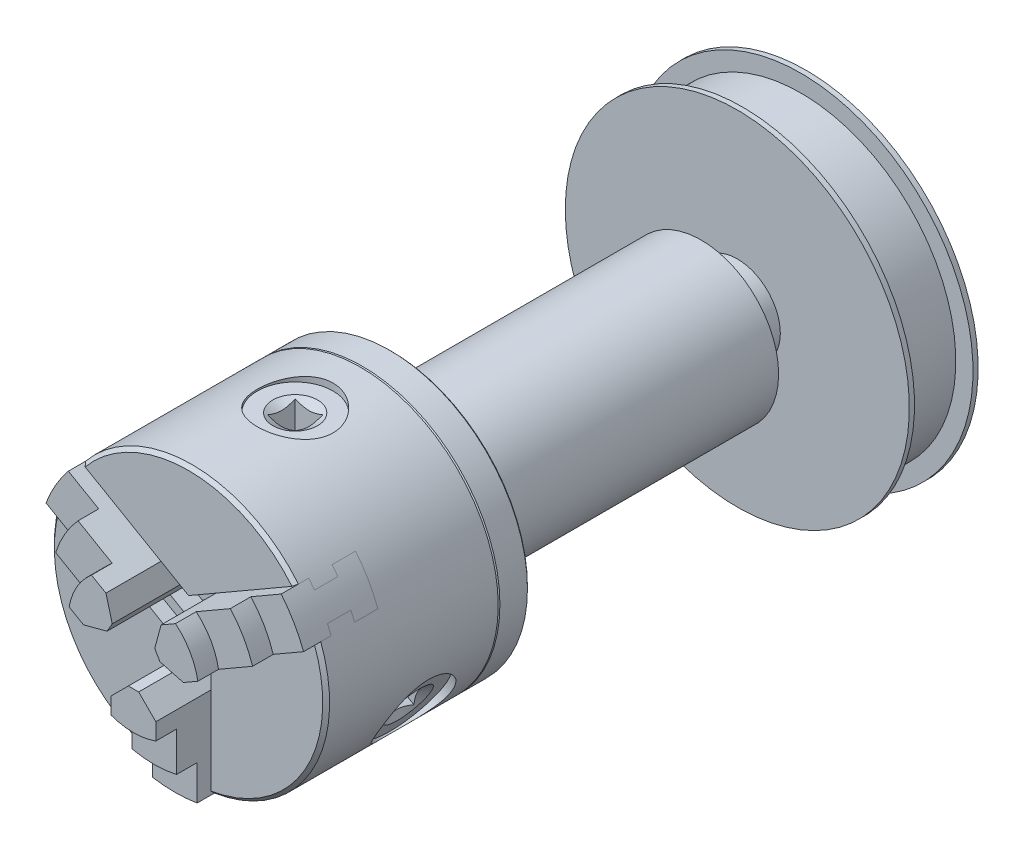
from build123d import *

# Parameters (mm, degrees)
SKETCH1_R            = 22.5
BOSS_EXTRUDE1_DEPTH  = 80
SKETCH2_R            = 12.5
BOSS_EXTRUDE2_DEPTH  = 10.5
SKETCH3_R            = 50
BOSS_EXTRUDE3_DEPTH  = 1.5
SKETCH4_R            = 45
BOSS_EXTRUDE4_DEPTH  = 17
SKETCH5_R            = 50
BOSS_EXTRUDE5_DEPTH  = 1.5
SKETCH6_R            = 12.5
BOSS_EXTRUDE6_DEPTH  = 1.5
SKETCH7_R            = 6
BOSS_EXTRUDE7_DEPTH  = 8
BOSS_EXTRUDE8_START  = 2
SKETCH8_R            = 12.5
BOSS_EXTRUDE8_DEPTH  = 2
SKETCH9_R            = 22.5
BOSS_EXTRUDE9_DEPTH  = 8
SKETCH10_R           = 40
BOSS_EXTRUDE10_DEPTH = 9
CHAMFER1_SIZE        = 0.5
SKETCH11_R           = 40
BOSS_EXTRUDE11_DEPTH = 50
CHAMFER2_SIZE        = 1
CUT_EXTRUDE1_START   = 38
SKETCH12_R           = 11
CUT_EXTRUDE1_DEPTH   = 127.927256692
SKETCH13_W           = 8
SKETCH13_H           = 8
CUT_EXTRUDE2_DEPTH   = 13
CIRPATTERN1_COUNT    = 3
CUT_EXTRUDE4_DEPTH   = 165.927256692
CIRPATTERN2_COUNT    = 3
BOSS_EXTRUDE12_START = -8
BOSS_EXTRUDE12_DEPTH = 32
CHAMFER3_SIZE        = 5
CIRPATTERN6_COUNT    = 3
SKETCH18_R           = 56.962173473
SKETCH18_R_2         = 19
CUT_EXTRUDE5_DEPTH   = 6
SKETCH20_R           = 66.142717287
SKETCH20_R_2         = 30
CUT_EXTRUDE6_DEPTH   = 6
CUT_EXTRUDE7_START   = -25
SKETCH21_R           = 72.147326136
SKETCH21_R_2         = 40
CUT_EXTRUDE7_DEPTH   = 25


with BuildPart() as part:
    # Sketch1 → Boss-Extrude1 (new body)
    with BuildSketch(Plane.XY):
        Circle(SKETCH1_R)
    extrude(amount=BOSS_EXTRUDE1_DEPTH)

    # Sketch2 → Boss-Extrude2 (add)
    with BuildSketch(Plane(origin=(0, 0, 0), x_dir=(-1, 0, 0), z_dir=(0, 0, -1))):
        Circle(SKETCH2_R)
    extrude(amount=BOSS_EXTRUDE2_DEPTH)

    # Sketch3 → Boss-Extrude3 (add)
    with BuildSketch(Plane(origin=(0, 0, -10.5), x_dir=(-1, 0, 0), z_dir=(0, 0, -1))):
        Circle(SKETCH3_R)
    extrude(amount=BOSS_EXTRUDE3_DEPTH)

    # Sketch4 → Boss-Extrude4 (add)
    with BuildSketch(Plane(origin=(0, 0, -12), x_dir=(-1, 0, 0), z_dir=(0, 0, -1))):
        Circle(SKETCH4_R)
    extrude(amount=BOSS_EXTRUDE4_DEPTH)

    # Sketch5 → Boss-Extrude5 (add)
    with BuildSketch(Plane(origin=(0, 0, -29), x_dir=(-1, 0, 0), z_dir=(0, 0, -1))):
        Circle(SKETCH5_R)
    extrude(amount=BOSS_EXTRUDE5_DEPTH)

    # Sketch8 → Boss-Extrude8 (add)
    with BuildSketch(Plane.XY.offset(80).offset(BOSS_EXTRUDE8_START)):
        Circle(SKETCH8_R)
    extrude(amount=-BOSS_EXTRUDE8_DEPTH)

    # Sketch9 → Boss-Extrude9 (add)
    with BuildSketch(Plane.XY.offset(82)):
        Circle(SKETCH9_R)
    extrude(amount=BOSS_EXTRUDE9_DEPTH)

    # Sketch10 → Boss-Extrude10 (add)
    with BuildSketch(Plane.XY.offset(90)):
        Circle(SKETCH10_R)
    extrude(amount=BOSS_EXTRUDE10_DEPTH)

    # Chamfer1
    chamfer1_edges = [part.edges().sort_by_distance(p)[0] for p in [
        (-40, 0, 99),
        (-40, 0, 90),
    ]]
    chamfer(chamfer1_edges, length=CHAMFER1_SIZE)

    # Sketch11 → Boss-Extrude11 (add)
    with BuildSketch(Plane.XY.offset(99)):
        Circle(SKETCH11_R)
    extrude(amount=BOSS_EXTRUDE11_DEPTH)

    # Chamfer2
    chamfer2_edges = [part.edges().sort_by_distance(p)[0] for p in [
        (-40, 0, 149),
    ]]
    chamfer(chamfer2_edges, length=CHAMFER2_SIZE)

    # Sketch12 → Cut-Extrude1 (cut, through all)
    with BuildSketch(Plane(origin=(0, 0, 0), x_dir=(1, 0, 0), z_dir=(0, 1, 0)).offset(CUT_EXTRUDE1_START)):
        with Locations((0, -118)):
            Circle(SKETCH12_R)
    cut_extrude1 = extrude(amount=CUT_EXTRUDE1_DEPTH, mode=Mode.SUBTRACT)

    # Sketch13 → Cut-Extrude2 (cut)
    with BuildSketch(Plane(origin=(0, 38, 0), x_dir=(1, 0, 0), z_dir=(0, 1, 0))):
        with Locations((0, -118)):
            Rectangle(SKETCH13_W, SKETCH13_H)
    cut_extrude2 = extrude(amount=-CUT_EXTRUDE2_DEPTH, mode=Mode.SUBTRACT)

    # Cut-Extrude3 cone 1 section (through the dimple's axis) → Cut-Extrude3 (revolve, cut)
    with BuildSketch(Plane(origin=(0, 38, 118), x_dir=(0, 0, 1), z_dir=(1, 0, 0))):
        Polygon((0, 0), (6.5, 0), (0, 3.75277675), align=None)
    cut_extrude3 = revolve(axis=Axis((0, 38, 118), (0, -1, 0)), mode=Mode.SUBTRACT)

    # CirPattern1: Cut-Extrude1, Cut-Extrude2, Cut-Extrude3 ×3 about axis
    cirpattern1_axis = Axis((0, 0, 149), (0, 0, 1))
    add([cut_extrude1.rotate(cirpattern1_axis, i * 360 / CIRPATTERN1_COUNT) for i in range(1, CIRPATTERN1_COUNT)], mode=Mode.SUBTRACT)
    add([cut_extrude2.rotate(cirpattern1_axis, i * 360 / CIRPATTERN1_COUNT) for i in range(1, CIRPATTERN1_COUNT)], mode=Mode.SUBTRACT)
    add([cut_extrude3.rotate(cirpattern1_axis, i * 360 / CIRPATTERN1_COUNT) for i in range(1, CIRPATTERN1_COUNT)], mode=Mode.SUBTRACT)

    # Sketch16 → Cut-Extrude4 (cut, through all)
    with BuildSketch(Plane(origin=(0, 0, 0), x_dir=(1, 0, 0), z_dir=(0, 1, 0))):
        Polygon((-6.5, -153), (-3.767510544, -153), (-3.767510544, -155.2), (3.767510544, -155.2), (3.767510544, -153), (6.5, -153), (6.5, -145), (3.767510544, -145), (3.767510544, -138.2), (6.5, -138.2), (6.5, -131.4), (-6.5, -131.4), (-6.5, -138.2), (-3.767510544, -138.2), (-3.767510544, -145), (-6.5, -145), align=None)
    cut_extrude4 = extrude(amount=-CUT_EXTRUDE4_DEPTH, mode=Mode.SUBTRACT)

    # CirPattern2: Cut-Extrude4 ×3 about axis
    cirpattern2_axis = Axis((0, 0, 149), (0, 0, 1))
    for i in range(1, CIRPATTERN2_COUNT):
        add(cut_extrude4.rotate(cirpattern2_axis, i * 360 / CIRPATTERN2_COUNT), mode=Mode.SUBTRACT)


with BuildPart() as body_2:
    # Sketch6 → Boss-Extrude6 (new body)
    with BuildSketch(Plane(origin=(0, 0, -30.5), x_dir=(-1, 0, 0), z_dir=(0, 0, -1))):
        Circle(SKETCH6_R)
    extrude(amount=BOSS_EXTRUDE6_DEPTH)


with BuildPart() as body_3:
    # Sketch7 → Boss-Extrude7 (new body)
    with BuildSketch(Plane(origin=(0, 0, -32), x_dir=(-1, 0, 0), z_dir=(0, 0, -1))):
        Circle(SKETCH7_R)
    extrude(amount=BOSS_EXTRUDE7_DEPTH)


with BuildPart() as body_4:
    # Sketch17 → Boss-Extrude12 (new body)
    with BuildSketch(Plane(origin=(0, 0, 0), x_dir=(1, 0, 0), z_dir=(0, 1, 0)).offset(BOSS_EXTRUDE12_START)):
        Polygon((-6.5, -165), (6.5, -165), (6.5, -145), (3.767510544, -145), (3.767510544, -138.2), (6.5, -138.2), (6.5, -131.4), (-6.5, -131.4), (-6.5, -138.2), (-3.767510544, -138.2), (-3.767510544, -145), (-6.5, -145), align=None)
    extrude(amount=-BOSS_EXTRUDE12_DEPTH)

    # Chamfer3
    chamfer3_edges = [body_4.edges().sort_by_distance(p)[0] for p in [
        (-6.5, -8, 155),
        (6.5, -8, 155),
    ]]
    chamfer(chamfer3_edges, length=CHAMFER3_SIZE)


with BuildPart() as cirpattern6_1:
    # CirPattern6: pattern copy
    add(body_4.part.rotate(Axis((0, 0, 148), (0, 0, -1)), 1 * 360 / CIRPATTERN6_COUNT))


with BuildPart() as cirpattern6_2:
    # CirPattern6: pattern copy
    add(body_4.part.rotate(Axis((0, 0, 148), (0, 0, -1)), 2 * 360 / CIRPATTERN6_COUNT))


with BuildPart() as cut_extrude5_tool:
    # Sketch18 → Cut-Extrude5 (new body)
    with BuildSketch(Plane.XY.offset(165)):
        Circle(SKETCH18_R)
        Circle(SKETCH18_R_2, mode=Mode.SUBTRACT)
    extrude(amount=-CUT_EXTRUDE5_DEPTH)


with BuildPart() as body_4_1:
    add(body_4.part)

    # Cut-Extrude5: cut by cut_extrude5_tool
    add(cut_extrude5_tool.part, mode=Mode.SUBTRACT)


with BuildPart() as cirpattern6_1_1:
    add(cirpattern6_1.part)

    # Cut-Extrude5: cut by cut_extrude5_tool
    add(cut_extrude5_tool.part, mode=Mode.SUBTRACT)


with BuildPart() as cirpattern6_2_1:
    add(cirpattern6_2.part)

    # Cut-Extrude5: cut by cut_extrude5_tool
    add(cut_extrude5_tool.part, mode=Mode.SUBTRACT)


with BuildPart() as cut_extrude6_tool:
    # Sketch20 → Cut-Extrude6 (new body)
    with BuildSketch(Plane.XY.offset(159)):
        Circle(SKETCH20_R)
        Circle(SKETCH20_R_2, mode=Mode.SUBTRACT)
    extrude(amount=-CUT_EXTRUDE6_DEPTH)


with BuildPart() as body_4_2:
    add(body_4_1.part)

    # Cut-Extrude6: cut by cut_extrude6_tool
    add(cut_extrude6_tool.part, mode=Mode.SUBTRACT)


with BuildPart() as cirpattern6_1_2:
    add(cirpattern6_1_1.part)

    # Cut-Extrude6: cut by cut_extrude6_tool
    add(cut_extrude6_tool.part, mode=Mode.SUBTRACT)


with BuildPart() as cirpattern6_2_2:
    add(cirpattern6_2_1.part)

    # Cut-Extrude6: cut by cut_extrude6_tool
    add(cut_extrude6_tool.part, mode=Mode.SUBTRACT)


with BuildPart() as cut_extrude7_tool:
    # Sketch21 → Cut-Extrude7 (new body)
    with BuildSketch(Plane.XY.offset(153).offset(CUT_EXTRUDE7_START)):
        Circle(SKETCH21_R)
        Circle(SKETCH21_R_2, mode=Mode.SUBTRACT)
    extrude(amount=CUT_EXTRUDE7_DEPTH)


with BuildPart() as body_4_3:
    add(body_4_2.part)

    # Cut-Extrude7: cut by cut_extrude7_tool
    add(cut_extrude7_tool.part, mode=Mode.SUBTRACT)


with BuildPart() as cirpattern6_1_3:
    add(cirpattern6_1_2.part)

    # Cut-Extrude7: cut by cut_extrude7_tool
    add(cut_extrude7_tool.part, mode=Mode.SUBTRACT)


with BuildPart() as cirpattern6_2_3:
    add(cirpattern6_2_2.part)

    # Cut-Extrude7: cut by cut_extrude7_tool
    add(cut_extrude7_tool.part, mode=Mode.SUBTRACT)


solid = Compound([part.part, body_2.part, body_3.part, body_4_3.part, cirpattern6_1_3.part, cirpattern6_2_3.part])
